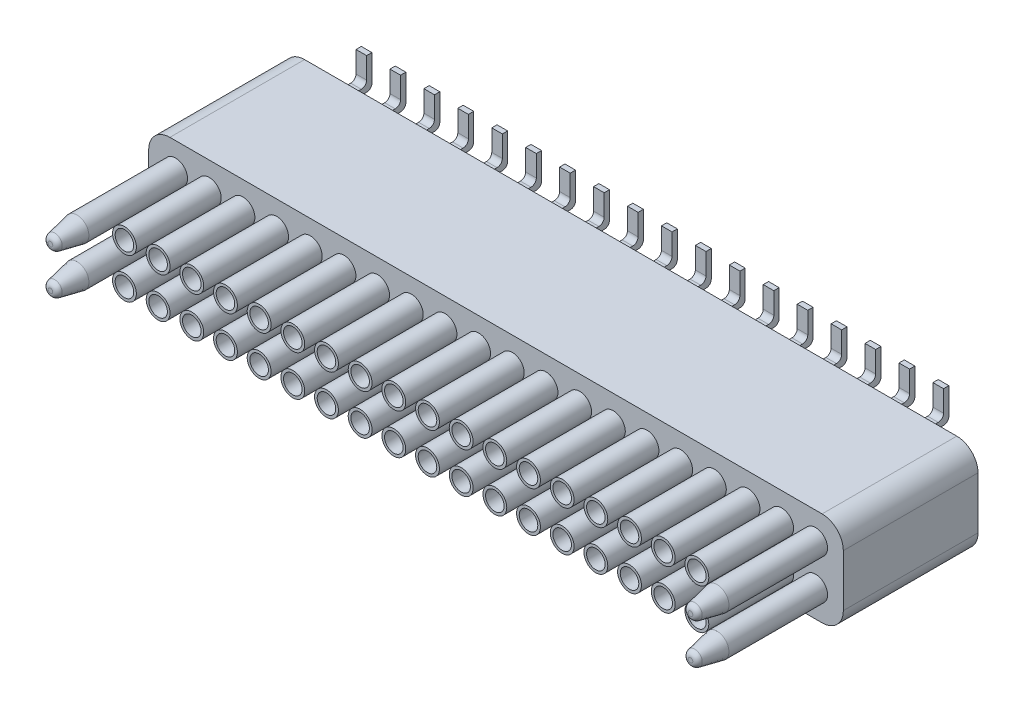
from build123d import *

# Parameters (mm, degrees)
SKETCH1_W                   = 13.1
SKETCH1_H                   = 1.78
BOSS_EXTRUDE1_DEPTH         = 2.54
SKETCH13_R                  = 0.225
SKETCH13_R_2                = 0.175
BOSS_EXTRUDE4_DEPTH         = 1.6
LPATTERN3_COUNT             = 18
LPATTERN3_PITCH             = 0.635
SKETCH14_R                  = 0.225
BOSS_EXTRUDE5_DEPTH         = 2.36
CHAMFER1_SIZE               = 0.5
CHAMFER1_SIZE2              = 0.1
FILLET2_R                   = 0.1
LPATTERN5_COUNT             = 2
LPATTERN5_PITCH             = 12.07
CHAMFER1_OF_LPATTERN5_SIZE2 = 0.1
CHAMFER1_OF_LPATTERN5_SIZE  = 0.5
FILLET2_OF_LPATTERN5_R      = 0.1
MIRROR2_START               = 2.54
MIRROR2_OUTLINE_R           = 0.225
MIRROR2_OUTLINE_R_2         = 0.175
MIRROR2_DEPTH               = 1.6
BOSS_EXTRUDE3_DEPTH         = 0.2
LPATTERN2_COUNT             = 18
LPATTERN2_PITCH             = 0.64
MIRROR1_COPY_1_DEPTH        = 0.2
MIRROR1_COPY_2_DEPTH        = 0.2
MIRROR1_COPY_3_DEPTH        = 0.2
MIRROR1_COPY_4_DEPTH        = 0.2
MIRROR1_COPY_5_DEPTH        = 0.2
MIRROR1_COPY_6_DEPTH        = 0.2
MIRROR1_COPY_7_DEPTH        = 0.2
MIRROR1_COPY_8_DEPTH        = 0.2
MIRROR1_COPY_9_DEPTH        = 0.2
MIRROR1_COPY_10_DEPTH       = 0.2
MIRROR1_COPY_11_DEPTH       = 0.2
MIRROR1_COPY_12_DEPTH       = 0.2
MIRROR1_COPY_13_DEPTH       = 0.2
MIRROR1_COPY_14_DEPTH       = 0.2
MIRROR1_COPY_15_DEPTH       = 0.2
MIRROR1_COPY_16_DEPTH       = 0.2
MIRROR1_COPY_17_DEPTH       = 0.2
FILLET1_R                   = 0.4


# Read off the part's stored shape, not the designer's step: Mirror2
with BuildPart() as part:
    # Sketch1 → Boss-Extrude1 (new body)
    with BuildSketch(Plane.XY):
        Rectangle(SKETCH1_W, SKETCH1_H)
    extrude(amount=BOSS_EXTRUDE1_DEPTH)

    # Sketch13 → Boss-Extrude4 (add)
    with BuildSketch(Plane.XY.offset(2.54)):
        with Locations(Location((-5.407, 0.381, 0), (0, 0, 180))):
            Circle(SKETCH13_R)
        with Locations((-5.407, 0.381)):
            Circle(SKETCH13_R_2, mode=Mode.SUBTRACT)
    boss_extrude4 = extrude(amount=BOSS_EXTRUDE4_DEPTH)

    # LPattern3: Boss-Extrude4 ×18
    with Locations(*[(i * LPATTERN3_PITCH, 0, 0) for i in range(1, LPATTERN3_COUNT)]):
        add(boss_extrude4)

    # Sketch14 → Boss-Extrude5 (add)
    with BuildSketch(Plane.XY.offset(2.54)):
        with Locations(Location((-6.042, 0.381, 0), (0, 0, 180))):
            Circle(SKETCH14_R)
    boss_extrude5 = extrude(amount=BOSS_EXTRUDE5_DEPTH)

    # Chamfer1
    chamfer1_edges = [part.edges().sort_by_distance(p)[0] for p in [
        (-5.817, 0.381, 4.9),
    ]]
    chamfer1_side = [part.faces().sort_by_distance(p)[0] for p in [
        (-5.817, 0.381, 3.72),
    ]]
    chamfer(chamfer1_edges, length=CHAMFER1_SIZE, length2=CHAMFER1_SIZE2, reference=chamfer1_side[0])

    # Fillet2
    fillet2_edges = [part.edges().sort_by_distance(p)[0] for p in [
        (-5.917, 0.381, 4.9),
    ]]
    fillet(fillet2_edges, radius=FILLET2_R)

    # LPattern5: Boss-Extrude5 ×2
    with Locations(*[(i * LPATTERN5_PITCH, 0, 0) for i in range(1, LPATTERN5_COUNT)]):
        add(boss_extrude5)

    # Chamfer1 of LPattern5
    chamfer1_of_lpattern5_edges = [part.edges().sort_by_distance(p)[0] for p in [
        (6.253, 0.381, 4.9),
    ]]
    chamfer(chamfer1_of_lpattern5_edges, length=CHAMFER1_OF_LPATTERN5_SIZE, length2=CHAMFER1_OF_LPATTERN5_SIZE2)

    # Fillet2 of LPattern5
    fillet2_of_lpattern5_edges = [part.edges().sort_by_distance(p)[0] for p in [
        (6.153, 0.381, 4.9),
    ]]
    fillet(fillet2_of_lpattern5_edges, radius=FILLET2_OF_LPATTERN5_R)

    # Mirror2 outline → Mirror2 (add)
    # profile 1 of 18: a face of its own
    with BuildSketch(Plane.XY.offset(MIRROR2_START)):
        with Locations((-5.407, -0.381)):
            Circle(MIRROR2_OUTLINE_R)
        with Locations((-5.407, -0.381)):
            Circle(MIRROR2_OUTLINE_R_2, mode=Mode.SUBTRACT)
    # profile 2 of 18: a face of its own
    with BuildSketch(Plane.XY.offset(MIRROR2_START)):
        with Locations((-4.772, -0.381)):
            Circle(MIRROR2_OUTLINE_R)
        with Locations((-4.772, -0.381)):
            Circle(MIRROR2_OUTLINE_R_2, mode=Mode.SUBTRACT)
    # profile 3 of 18: a face of its own
    with BuildSketch(Plane.XY.offset(MIRROR2_START)):
        with Locations((-4.137, -0.381)):
            Circle(MIRROR2_OUTLINE_R)
        with Locations((-4.137, -0.381)):
            Circle(MIRROR2_OUTLINE_R_2, mode=Mode.SUBTRACT)
    # profile 4 of 18: a face of its own
    with BuildSketch(Plane.XY.offset(MIRROR2_START)):
        with Locations((-3.502, -0.381)):
            Circle(MIRROR2_OUTLINE_R)
        with Locations((-3.502, -0.381)):
            Circle(MIRROR2_OUTLINE_R_2, mode=Mode.SUBTRACT)
    # profile 5 of 18: a face of its own
    with BuildSketch(Plane.XY.offset(MIRROR2_START)):
        with Locations((-2.867, -0.381)):
            Circle(MIRROR2_OUTLINE_R)
        with Locations((-2.867, -0.381)):
            Circle(MIRROR2_OUTLINE_R_2, mode=Mode.SUBTRACT)
    # profile 6 of 18: a face of its own
    with BuildSketch(Plane.XY.offset(MIRROR2_START)):
        with Locations((-2.232, -0.381)):
            Circle(MIRROR2_OUTLINE_R)
        with Locations((-2.232, -0.381)):
            Circle(MIRROR2_OUTLINE_R_2, mode=Mode.SUBTRACT)
    # profile 7 of 18: a face of its own
    with BuildSketch(Plane.XY.offset(MIRROR2_START)):
        with Locations((-1.597, -0.381)):
            Circle(MIRROR2_OUTLINE_R)
        with Locations((-1.597, -0.381)):
            Circle(MIRROR2_OUTLINE_R_2, mode=Mode.SUBTRACT)
    # profile 8 of 18: a face of its own
    with BuildSketch(Plane.XY.offset(MIRROR2_START)):
        with Locations((-0.962, -0.381)):
            Circle(MIRROR2_OUTLINE_R)
        with Locations((-0.962, -0.381)):
            Circle(MIRROR2_OUTLINE_R_2, mode=Mode.SUBTRACT)
    # profile 9 of 18: a face of its own
    with BuildSketch(Plane.XY.offset(MIRROR2_START)):
        with Locations((-0.327, -0.381)):
            Circle(MIRROR2_OUTLINE_R)
        with Locations((-0.327, -0.381)):
            Circle(MIRROR2_OUTLINE_R_2, mode=Mode.SUBTRACT)
    # profile 10 of 18: a face of its own
    with BuildSketch(Plane.XY.offset(MIRROR2_START)):
        with Locations((0.308, -0.381)):
            Circle(MIRROR2_OUTLINE_R)
        with Locations((0.308, -0.381)):
            Circle(MIRROR2_OUTLINE_R_2, mode=Mode.SUBTRACT)
    # profile 11 of 18: a face of its own
    with BuildSketch(Plane.XY.offset(MIRROR2_START)):
        with Locations((0.943, -0.381)):
            Circle(MIRROR2_OUTLINE_R)
        with Locations((0.943, -0.381)):
            Circle(MIRROR2_OUTLINE_R_2, mode=Mode.SUBTRACT)
    # profile 12 of 18: a face of its own
    with BuildSketch(Plane.XY.offset(MIRROR2_START)):
        with Locations((1.578, -0.381)):
            Circle(MIRROR2_OUTLINE_R)
        with Locations((1.578, -0.381)):
            Circle(MIRROR2_OUTLINE_R_2, mode=Mode.SUBTRACT)
    # profile 13 of 18: a face of its own
    with BuildSketch(Plane.XY.offset(MIRROR2_START)):
        with Locations((2.213, -0.381)):
            Circle(MIRROR2_OUTLINE_R)
        with Locations((2.213, -0.381)):
            Circle(MIRROR2_OUTLINE_R_2, mode=Mode.SUBTRACT)
    # profile 14 of 18: a face of its own
    with BuildSketch(Plane.XY.offset(MIRROR2_START)):
        with Locations((2.848, -0.381)):
            Circle(MIRROR2_OUTLINE_R)
        with Locations((2.848, -0.381)):
            Circle(MIRROR2_OUTLINE_R_2, mode=Mode.SUBTRACT)
    # profile 15 of 18: a face of its own
    with BuildSketch(Plane.XY.offset(MIRROR2_START)):
        with Locations((3.483, -0.381)):
            Circle(MIRROR2_OUTLINE_R)
        with Locations((3.483, -0.381)):
            Circle(MIRROR2_OUTLINE_R_2, mode=Mode.SUBTRACT)
    # profile 16 of 18: a face of its own
    with BuildSketch(Plane.XY.offset(MIRROR2_START)):
        with Locations((4.118, -0.381)):
            Circle(MIRROR2_OUTLINE_R)
        with Locations((4.118, -0.381)):
            Circle(MIRROR2_OUTLINE_R_2, mode=Mode.SUBTRACT)
    # profile 17 of 18: a face of its own
    with BuildSketch(Plane.XY.offset(MIRROR2_START)):
        with Locations((4.753, -0.381)):
            Circle(MIRROR2_OUTLINE_R)
        with Locations((4.753, -0.381)):
            Circle(MIRROR2_OUTLINE_R_2, mode=Mode.SUBTRACT)
    # profile 18 of 18: a face of its own
    with BuildSketch(Plane.XY.offset(MIRROR2_START)):
        with Locations((5.388, -0.381)):
            Circle(MIRROR2_OUTLINE_R)
        with Locations((5.388, -0.381)):
            Circle(MIRROR2_OUTLINE_R_2, mode=Mode.SUBTRACT)
    extrude(amount=MIRROR2_DEPTH)

    # Mirror2 2 outline → Mirror2 2 (revolve)
    with BuildSketch(Plane(origin=(-6.042, -0.381, 0), x_dir=(1, 0, 0), z_dir=(0, -1, 0))):
        with BuildLine():
            Line((0.04301961, 4.9), (0, 4.9))
            Line((0, 4.9), (0, 2.54))
            Line((0, 2.54), (0.225, 2.54))
            Line((0.225, 2.54), (0.225, 4.4))
            Line((0.225, 4.4), (0.141077677, 4.819611614))
            ThreePointArc((0.141077677, 4.819611614), (0.1064185, 4.877334214), (0.04301961, 4.9))
        make_face()
    revolve(axis=Axis((-6.042, -0.381, 0), (0, 0, 1)))

    # Mirror2 3 outline → Mirror2 3 (revolve)
    with BuildSketch(Plane(origin=(6.028, -0.381, 0), x_dir=(1, 0, 0), z_dir=(0, -1, 0))):
        with BuildLine():
            Line((0.04301961, 4.9), (0, 4.9))
            Line((0, 4.9), (0, 2.54))
            Line((0, 2.54), (0.225, 2.54))
            Line((0.225, 2.54), (0.225, 4.4))
            Line((0.225, 4.4), (0.141077677, 4.819611614))
            ThreePointArc((0.141077677, 4.819611614), (0.1064185, 4.877334214), (0.04301961, 4.9))
        make_face()
    revolve(axis=Axis((6.028, -0.381, 0), (0, 0, 1)))

    # Sketch12 → Boss-Extrude3 (add)
    with BuildSketch(Plane(origin=(5.5, 0, 0), x_dir=(0, 0, -1), z_dir=(1, 0, 0))):
        with BuildLine():
            Line((0, 0.54), (0.4, 0.54))
            ThreePointArc((0.4, 0.54), (0.470710678, 0.569289322), (0.5, 0.64))
            Line((0.5, 0.64), (0.5, 1.14))
            Line((0.5, 1.14), (0.4, 1.14))
            Line((0.4, 1.14), (0.4, 0.74))
            ThreePointArc((0.4, 0.74), (0.370710678, 0.669289322), (0.3, 0.64))
            Line((0.3, 0.64), (0, 0.64))
            Line((0, 0.64), (0, 0.54))
        make_face()
    boss_extrude3 = extrude(amount=-BOSS_EXTRUDE3_DEPTH)

    # LPattern2: Boss-Extrude3 ×18
    with Locations(*[(-i * LPATTERN2_PITCH, 0, 0) for i in range(1, LPATTERN2_COUNT)]):
        add(boss_extrude3)

    # Mirror1: Boss-Extrude3 across plane
    add(boss_extrude3.mirror(Plane.ZX))

    # Mirror1 copy 1 sketch → Mirror1 copy 1 (add)
    with BuildSketch(Plane(origin=(4.86, 0, 0), x_dir=(0, 0, -1), z_dir=(1, 0, 0))):
        with BuildLine():
            Line((0, -0.54), (0.4, -0.54))
            ThreePointArc((0.4, -0.54), (0.470710678, -0.569289322), (0.5, -0.64))
            Line((0.5, -0.64), (0.5, -1.14))
            Line((0.5, -1.14), (0.4, -1.14))
            Line((0.4, -1.14), (0.4, -0.74))
            ThreePointArc((0.4, -0.74), (0.370710678, -0.669289322), (0.3, -0.64))
            Line((0.3, -0.64), (0, -0.64))
            Line((0, -0.64), (0, -0.54))
        make_face()
    extrude(amount=-MIRROR1_COPY_1_DEPTH)

    # Mirror1 copy 2 sketch → Mirror1 copy 2 (add)
    with BuildSketch(Plane(origin=(4.22, 0, 0), x_dir=(0, 0, -1), z_dir=(1, 0, 0))):
        with BuildLine():
            Line((0, -0.54), (0.4, -0.54))
            ThreePointArc((0.4, -0.54), (0.470710678, -0.569289322), (0.5, -0.64))
            Line((0.5, -0.64), (0.5, -1.14))
            Line((0.5, -1.14), (0.4, -1.14))
            Line((0.4, -1.14), (0.4, -0.74))
            ThreePointArc((0.4, -0.74), (0.370710678, -0.669289322), (0.3, -0.64))
            Line((0.3, -0.64), (0, -0.64))
            Line((0, -0.64), (0, -0.54))
        make_face()
    extrude(amount=-MIRROR1_COPY_2_DEPTH)

    # Mirror1 copy 3 sketch → Mirror1 copy 3 (add)
    with BuildSketch(Plane(origin=(3.58, 0, 0), x_dir=(0, 0, -1), z_dir=(1, 0, 0))):
        with BuildLine():
            Line((0, -0.54), (0.4, -0.54))
            ThreePointArc((0.4, -0.54), (0.470710678, -0.569289322), (0.5, -0.64))
            Line((0.5, -0.64), (0.5, -1.14))
            Line((0.5, -1.14), (0.4, -1.14))
            Line((0.4, -1.14), (0.4, -0.74))
            ThreePointArc((0.4, -0.74), (0.370710678, -0.669289322), (0.3, -0.64))
            Line((0.3, -0.64), (0, -0.64))
            Line((0, -0.64), (0, -0.54))
        make_face()
    extrude(amount=-MIRROR1_COPY_3_DEPTH)

    # Mirror1 copy 4 sketch → Mirror1 copy 4 (add)
    with BuildSketch(Plane(origin=(2.94, 0, 0), x_dir=(0, 0, -1), z_dir=(1, 0, 0))):
        with BuildLine():
            Line((0, -0.54), (0.4, -0.54))
            ThreePointArc((0.4, -0.54), (0.470710678, -0.569289322), (0.5, -0.64))
            Line((0.5, -0.64), (0.5, -1.14))
            Line((0.5, -1.14), (0.4, -1.14))
            Line((0.4, -1.14), (0.4, -0.74))
            ThreePointArc((0.4, -0.74), (0.370710678, -0.669289322), (0.3, -0.64))
            Line((0.3, -0.64), (0, -0.64))
            Line((0, -0.64), (0, -0.54))
        make_face()
    extrude(amount=-MIRROR1_COPY_4_DEPTH)

    # Mirror1 copy 5 sketch → Mirror1 copy 5 (add)
    with BuildSketch(Plane(origin=(2.3, 0, 0), x_dir=(0, 0, -1), z_dir=(1, 0, 0))):
        with BuildLine():
            Line((0, -0.54), (0.4, -0.54))
            ThreePointArc((0.4, -0.54), (0.470710678, -0.569289322), (0.5, -0.64))
            Line((0.5, -0.64), (0.5, -1.14))
            Line((0.5, -1.14), (0.4, -1.14))
            Line((0.4, -1.14), (0.4, -0.74))
            ThreePointArc((0.4, -0.74), (0.370710678, -0.669289322), (0.3, -0.64))
            Line((0.3, -0.64), (0, -0.64))
            Line((0, -0.64), (0, -0.54))
        make_face()
    extrude(amount=-MIRROR1_COPY_5_DEPTH)

    # Mirror1 copy 6 sketch → Mirror1 copy 6 (add)
    with BuildSketch(Plane(origin=(1.66, 0, 0), x_dir=(0, 0, -1), z_dir=(1, 0, 0))):
        with BuildLine():
            Line((0, -0.54), (0.4, -0.54))
            ThreePointArc((0.4, -0.54), (0.470710678, -0.569289322), (0.5, -0.64))
            Line((0.5, -0.64), (0.5, -1.14))
            Line((0.5, -1.14), (0.4, -1.14))
            Line((0.4, -1.14), (0.4, -0.74))
            ThreePointArc((0.4, -0.74), (0.370710678, -0.669289322), (0.3, -0.64))
            Line((0.3, -0.64), (0, -0.64))
            Line((0, -0.64), (0, -0.54))
        make_face()
    extrude(amount=-MIRROR1_COPY_6_DEPTH)

    # Mirror1 copy 7 sketch → Mirror1 copy 7 (add)
    with BuildSketch(Plane(origin=(1.02, 0, 0), x_dir=(0, 0, -1), z_dir=(1, 0, 0))):
        with BuildLine():
            Line((0, -0.54), (0.4, -0.54))
            ThreePointArc((0.4, -0.54), (0.470710678, -0.569289322), (0.5, -0.64))
            Line((0.5, -0.64), (0.5, -1.14))
            Line((0.5, -1.14), (0.4, -1.14))
            Line((0.4, -1.14), (0.4, -0.74))
            ThreePointArc((0.4, -0.74), (0.370710678, -0.669289322), (0.3, -0.64))
            Line((0.3, -0.64), (0, -0.64))
            Line((0, -0.64), (0, -0.54))
        make_face()
    extrude(amount=-MIRROR1_COPY_7_DEPTH)

    # Mirror1 copy 8 sketch → Mirror1 copy 8 (add)
    with BuildSketch(Plane(origin=(0.38, 0, 0), x_dir=(0, 0, -1), z_dir=(1, 0, 0))):
        with BuildLine():
            Line((0, -0.54), (0.4, -0.54))
            ThreePointArc((0.4, -0.54), (0.470710678, -0.569289322), (0.5, -0.64))
            Line((0.5, -0.64), (0.5, -1.14))
            Line((0.5, -1.14), (0.4, -1.14))
            Line((0.4, -1.14), (0.4, -0.74))
            ThreePointArc((0.4, -0.74), (0.370710678, -0.669289322), (0.3, -0.64))
            Line((0.3, -0.64), (0, -0.64))
            Line((0, -0.64), (0, -0.54))
        make_face()
    extrude(amount=-MIRROR1_COPY_8_DEPTH)

    # Mirror1 copy 9 sketch → Mirror1 copy 9 (add)
    with BuildSketch(Plane(origin=(-0.26, 0, 0), x_dir=(0, 0, -1), z_dir=(1, 0, 0))):
        with BuildLine():
            Line((0, -0.54), (0.4, -0.54))
            ThreePointArc((0.4, -0.54), (0.470710678, -0.569289322), (0.5, -0.64))
            Line((0.5, -0.64), (0.5, -1.14))
            Line((0.5, -1.14), (0.4, -1.14))
            Line((0.4, -1.14), (0.4, -0.74))
            ThreePointArc((0.4, -0.74), (0.370710678, -0.669289322), (0.3, -0.64))
            Line((0.3, -0.64), (0, -0.64))
            Line((0, -0.64), (0, -0.54))
        make_face()
    extrude(amount=-MIRROR1_COPY_9_DEPTH)

    # Mirror1 copy 10 sketch → Mirror1 copy 10 (add)
    with BuildSketch(Plane(origin=(-0.9, 0, 0), x_dir=(0, 0, -1), z_dir=(1, 0, 0))):
        with BuildLine():
            Line((0, -0.54), (0.4, -0.54))
            ThreePointArc((0.4, -0.54), (0.470710678, -0.569289322), (0.5, -0.64))
            Line((0.5, -0.64), (0.5, -1.14))
            Line((0.5, -1.14), (0.4, -1.14))
            Line((0.4, -1.14), (0.4, -0.74))
            ThreePointArc((0.4, -0.74), (0.370710678, -0.669289322), (0.3, -0.64))
            Line((0.3, -0.64), (0, -0.64))
            Line((0, -0.64), (0, -0.54))
        make_face()
    extrude(amount=-MIRROR1_COPY_10_DEPTH)

    # Mirror1 copy 11 sketch → Mirror1 copy 11 (add)
    with BuildSketch(Plane(origin=(-1.54, 0, 0), x_dir=(0, 0, -1), z_dir=(1, 0, 0))):
        with BuildLine():
            Line((0, -0.54), (0.4, -0.54))
            ThreePointArc((0.4, -0.54), (0.470710678, -0.569289322), (0.5, -0.64))
            Line((0.5, -0.64), (0.5, -1.14))
            Line((0.5, -1.14), (0.4, -1.14))
            Line((0.4, -1.14), (0.4, -0.74))
            ThreePointArc((0.4, -0.74), (0.370710678, -0.669289322), (0.3, -0.64))
            Line((0.3, -0.64), (0, -0.64))
            Line((0, -0.64), (0, -0.54))
        make_face()
    extrude(amount=-MIRROR1_COPY_11_DEPTH)

    # Mirror1 copy 12 sketch → Mirror1 copy 12 (add)
    with BuildSketch(Plane(origin=(-2.18, 0, 0), x_dir=(0, 0, -1), z_dir=(1, 0, 0))):
        with BuildLine():
            Line((0, -0.54), (0.4, -0.54))
            ThreePointArc((0.4, -0.54), (0.470710678, -0.569289322), (0.5, -0.64))
            Line((0.5, -0.64), (0.5, -1.14))
            Line((0.5, -1.14), (0.4, -1.14))
            Line((0.4, -1.14), (0.4, -0.74))
            ThreePointArc((0.4, -0.74), (0.370710678, -0.669289322), (0.3, -0.64))
            Line((0.3, -0.64), (0, -0.64))
            Line((0, -0.64), (0, -0.54))
        make_face()
    extrude(amount=-MIRROR1_COPY_12_DEPTH)

    # Mirror1 copy 13 sketch → Mirror1 copy 13 (add)
    with BuildSketch(Plane(origin=(-2.82, 0, 0), x_dir=(0, 0, -1), z_dir=(1, 0, 0))):
        with BuildLine():
            Line((0, -0.54), (0.4, -0.54))
            ThreePointArc((0.4, -0.54), (0.470710678, -0.569289322), (0.5, -0.64))
            Line((0.5, -0.64), (0.5, -1.14))
            Line((0.5, -1.14), (0.4, -1.14))
            Line((0.4, -1.14), (0.4, -0.74))
            ThreePointArc((0.4, -0.74), (0.370710678, -0.669289322), (0.3, -0.64))
            Line((0.3, -0.64), (0, -0.64))
            Line((0, -0.64), (0, -0.54))
        make_face()
    extrude(amount=-MIRROR1_COPY_13_DEPTH)

    # Mirror1 copy 14 sketch → Mirror1 copy 14 (add)
    with BuildSketch(Plane(origin=(-3.46, 0, 0), x_dir=(0, 0, -1), z_dir=(1, 0, 0))):
        with BuildLine():
            Line((0, -0.54), (0.4, -0.54))
            ThreePointArc((0.4, -0.54), (0.470710678, -0.569289322), (0.5, -0.64))
            Line((0.5, -0.64), (0.5, -1.14))
            Line((0.5, -1.14), (0.4, -1.14))
            Line((0.4, -1.14), (0.4, -0.74))
            ThreePointArc((0.4, -0.74), (0.370710678, -0.669289322), (0.3, -0.64))
            Line((0.3, -0.64), (0, -0.64))
            Line((0, -0.64), (0, -0.54))
        make_face()
    extrude(amount=-MIRROR1_COPY_14_DEPTH)

    # Mirror1 copy 15 sketch → Mirror1 copy 15 (add)
    with BuildSketch(Plane(origin=(-4.1, 0, 0), x_dir=(0, 0, -1), z_dir=(1, 0, 0))):
        with BuildLine():
            Line((0, -0.54), (0.4, -0.54))
            ThreePointArc((0.4, -0.54), (0.470710678, -0.569289322), (0.5, -0.64))
            Line((0.5, -0.64), (0.5, -1.14))
            Line((0.5, -1.14), (0.4, -1.14))
            Line((0.4, -1.14), (0.4, -0.74))
            ThreePointArc((0.4, -0.74), (0.370710678, -0.669289322), (0.3, -0.64))
            Line((0.3, -0.64), (0, -0.64))
            Line((0, -0.64), (0, -0.54))
        make_face()
    extrude(amount=-MIRROR1_COPY_15_DEPTH)

    # Mirror1 copy 16 sketch → Mirror1 copy 16 (add)
    with BuildSketch(Plane(origin=(-4.74, 0, 0), x_dir=(0, 0, -1), z_dir=(1, 0, 0))):
        with BuildLine():
            Line((0, -0.54), (0.4, -0.54))
            ThreePointArc((0.4, -0.54), (0.470710678, -0.569289322), (0.5, -0.64))
            Line((0.5, -0.64), (0.5, -1.14))
            Line((0.5, -1.14), (0.4, -1.14))
            Line((0.4, -1.14), (0.4, -0.74))
            ThreePointArc((0.4, -0.74), (0.370710678, -0.669289322), (0.3, -0.64))
            Line((0.3, -0.64), (0, -0.64))
            Line((0, -0.64), (0, -0.54))
        make_face()
    extrude(amount=-MIRROR1_COPY_16_DEPTH)

    # Mirror1 copy 17 sketch → Mirror1 copy 17 (add)
    with BuildSketch(Plane(origin=(-5.38, 0, 0), x_dir=(0, 0, -1), z_dir=(1, 0, 0))):
        with BuildLine():
            Line((0, -0.54), (0.4, -0.54))
            ThreePointArc((0.4, -0.54), (0.470710678, -0.569289322), (0.5, -0.64))
            Line((0.5, -0.64), (0.5, -1.14))
            Line((0.5, -1.14), (0.4, -1.14))
            Line((0.4, -1.14), (0.4, -0.74))
            ThreePointArc((0.4, -0.74), (0.370710678, -0.669289322), (0.3, -0.64))
            Line((0.3, -0.64), (0, -0.64))
            Line((0, -0.64), (0, -0.54))
        make_face()
    extrude(amount=-MIRROR1_COPY_17_DEPTH)

    # Fillet1
    fillet1_edges = [part.edges().sort_by_distance(p)[0] for p in [
        (-6.55, 0.89, 1.27),
        (6.55, 0.89, 1.27),
        (6.55, -0.89, 1.27),
        (-6.55, -0.89, 1.27),
    ]]
    fillet(fillet1_edges, radius=FILLET1_R)


with BuildPart() as part_1:
    # Body-Move/Copy1: moved
    add(part.part.moved(Location((0, 0, 0.5))))


solid = part_1.part
